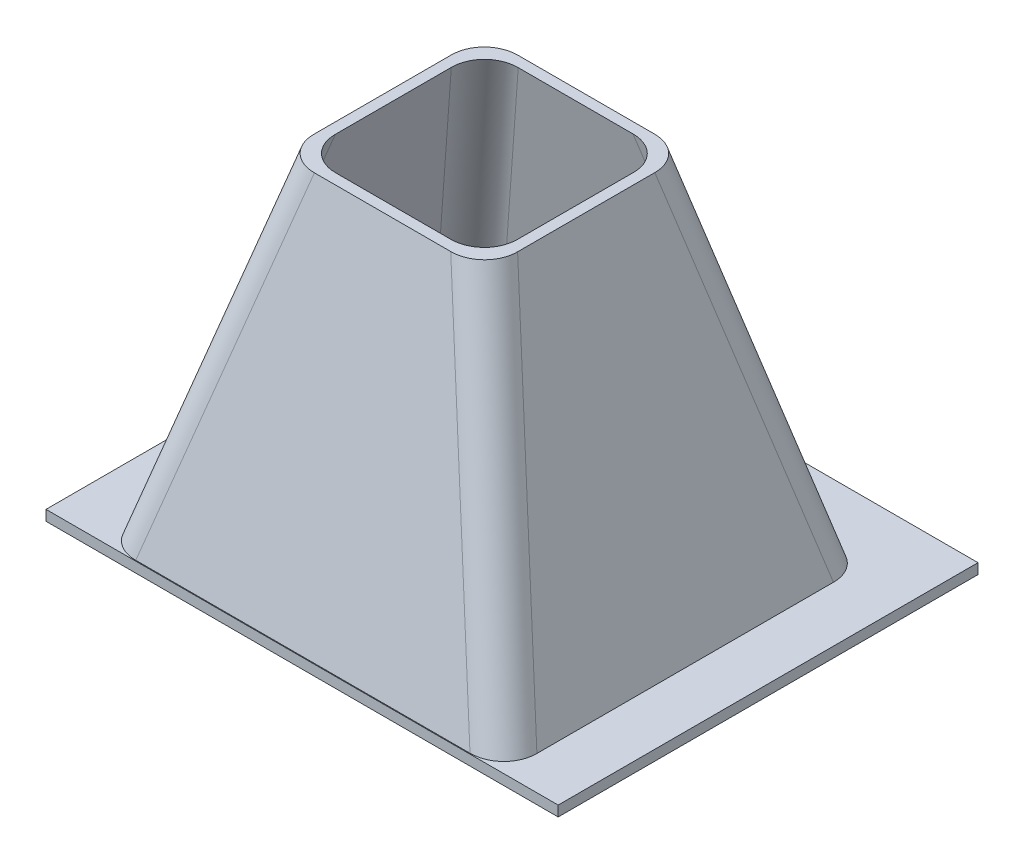
from build123d import *

# Parameters (mm, degrees)
SKETCH1_W           = 59
SKETCH1_H           = 59
BOSS_EXTRUDE1_DEPTH = 100
DRAFT1_ANGLE        = 13
DRAFT2_ANGLE        = 16
SHELL1_T            = -3
CUT_EXTRUDE3_REACH  = 126.734
SKETCH7_W           = 108.386808222
SKETCH7_H           = 97.630604432
SKETCH8_W           = 148.386808222
SKETCH8_H           = 137.630604432
SKETCH8_W_2         = 108.386808222
SKETCH8_H_2         = 97.630604432
BOSS_EXTRUDE7_DEPTH = 3
FILLET5_R           = 10
SKETCH9_R           = 3.5
CUT_EXTRUDE4_DEPTH  = 3
CUT_EXTRUDE5_REACH  = 146.393
SKETCH10_W          = 148.386808222
SKETCH10_H          = 16


with BuildPart() as part:
    # Sketch1 → Boss-Extrude1 (new body)
    with BuildSketch(Plane(origin=(0, 0, 0), x_dir=(1, 0, 0), z_dir=(0, 1, 0))):
        Rectangle(SKETCH1_W, SKETCH1_H)
    extrude(amount=-BOSS_EXTRUDE1_DEPTH)

    # Draft1
    draft1_faces = [part.faces().sort_by_distance(p)[0] for p in [
        (0, -50, 29.5),
        (0, -50, -29.5),
    ]]
    draft(draft1_faces, Plane.ZX, DRAFT1_ANGLE)

    # Draft2
    draft2_faces = [part.faces().sort_by_distance(p)[0] for p in [
        (-29.5, -54.687479947, 0),
        (29.5, -54.687479947, 0),
    ]]
    draft(draft2_faces, Plane.ZX, DRAFT2_ANGLE)

    # Shell1
    shell1_openings = [part.faces().sort_by_distance(p)[0] for p in [
        (0, 0, 0),
    ]]
    offset(amount=SHELL1_T, openings=shell1_openings, kind=Kind.INTERSECTION)

    # Sketch7 → Cut-Extrude3 (cut, up to next)
    with BuildSketch(Plane(origin=(0, -97, 0), x_dir=(1, 0, 0), z_dir=(0, 1, 0)), mode=Mode.PRIVATE) as cut_extrude3_sk1:
        Rectangle(SKETCH7_W, SKETCH7_H)
    cut_extrude3_tool1 = extrude(cut_extrude3_sk1.sketch, amount=-CUT_EXTRUDE3_REACH, mode=Mode.PRIVATE) & part.part
    add(cut_extrude3_tool1.solids().sort_by_distance((0, -97, 0))[0], mode=Mode.SUBTRACT)

    # Sketch8 → Boss-Extrude7 (add)
    with BuildSketch(Plane.XZ.offset(100)):
        Rectangle(SKETCH8_W, SKETCH8_H)
        Rectangle(SKETCH8_W_2, SKETCH8_H_2, mode=Mode.SUBTRACT)
    extrude(amount=BOSS_EXTRUDE7_DEPTH)

    # Fillet5
    # the kernel refuses this fillet: 10 mm, written as the material it adds along each edge
    with BuildSketch(Plane(origin=(60.515709798, -119.048500171, 53.905599567), x_dir=(0.05971785506372287, -0.20826091030442337, -0.9762485190901757), z_dir=(-0.26909056042227797, 0.9384303071178944, -0.2166537075017155))) as fillet5_piece_1_section:
        with BuildLine():
            CenterArc((FILLET5_R * 0.939803414436, FILLET5_R), FILLET5_R, 183.554900224, 86.445099776)
            Line((-FILLET5_R * 0.0582724297082, FILLET5_R * 0.937995086192), (0, 0))
            Line((0, 0), (FILLET5_R * 0.939803414436, 0))
        make_face()
    fillet5_piece_1 = extrude(amount=150.354266344, mode=Mode.PRIVATE)
    fillet5_piece_1 = split(fillet5_piece_1, bisect_by=Plane(origin=(38.566536387, -103, 35.845693728), z_dir=(0, 1, 0)), keep=Keep.TOP, mode=Mode.PRIVATE)
    fillet5_piece_1 = split(fillet5_piece_1, bisect_by=Plane(origin=(38.566536387, 0, 35.845693728), z_dir=(0, -1, 0)), keep=Keep.TOP, mode=Mode.PRIVATE)
    add(fillet5_piece_1)
    with BuildSketch(Plane(origin=(60.515709798, -119.048500171, -53.905599567), x_dir=(0.059717855063722874, -0.2082609103044234, 0.9762485190901756), z_dir=(-0.26909056042227797, 0.9384303071178944, 0.2166537075017155))) as fillet5_piece_2_section:
        with BuildLine():
            CenterArc((FILLET5_R * 0.939803414436, -FILLET5_R), FILLET5_R, 90, 86.445099776)
            Line((-FILLET5_R * 0.0582724297082, -FILLET5_R * 0.937995086192), (0, 0))
            Line((0, 0), (FILLET5_R * 0.939803414436, 0))
        make_face()
    fillet5_piece_2 = extrude(amount=150.354266344, mode=Mode.PRIVATE)
    fillet5_piece_2 = split(fillet5_piece_2, bisect_by=Plane(origin=(38.566536387, -103, -35.845693728), z_dir=(0, 1, 0)), keep=Keep.TOP, mode=Mode.PRIVATE)
    fillet5_piece_2 = split(fillet5_piece_2, bisect_by=Plane(origin=(38.566536387, 0, -35.845693728), z_dir=(0, -1, 0)), keep=Keep.TOP, mode=Mode.PRIVATE)
    add(fillet5_piece_2)
    with BuildSketch(Plane(origin=(-60.515709798, -119.048500171, -53.905599567), x_dir=(0.9631148790729092, -0.26219378679175015, -0.06053220528097297), z_dir=(0.26909056042227797, 0.9384303071178944, 0.2166537075017155))) as fillet5_piece_3_section:
        with BuildLine():
            CenterArc((FILLET5_R * 0.939803414436, -FILLET5_R), FILLET5_R, 90, 86.445099776)
            Line((-FILLET5_R * 0.0582724297082, -FILLET5_R * 0.937995086192), (0, 0))
            Line((0, 0), (FILLET5_R * 0.939803414436, 0))
        make_face()
    fillet5_piece_3 = extrude(amount=150.354266344, mode=Mode.PRIVATE)
    fillet5_piece_3 = split(fillet5_piece_3, bisect_by=Plane(origin=(-38.566536387, -103, -35.845693728), z_dir=(0, 1, 0)), keep=Keep.TOP, mode=Mode.PRIVATE)
    fillet5_piece_3 = split(fillet5_piece_3, bisect_by=Plane(origin=(-38.566536387, 0, -35.845693728), z_dir=(0, -1, 0)), keep=Keep.TOP, mode=Mode.PRIVATE)
    add(fillet5_piece_3)
    with BuildSketch(Plane(origin=(-20.056796005, 22.048500171, 21.330790325), x_dir=(-0.059717855063722264, -0.2082609103044235, -0.9762485190901756), z_dir=(-0.26909056042227797, -0.9384303071178944, 0.2166537075017155))) as fillet5_piece_4_section:
        with BuildLine():
            CenterArc((FILLET5_R * 0.939803414436, FILLET5_R), FILLET5_R, 183.554900224, 86.445099776)
            Line((-FILLET5_R * 0.0582724297082, FILLET5_R * 0.937995086192), (0, 0))
            Line((0, 0), (FILLET5_R * 0.939803414436, 0))
        make_face()
    fillet5_piece_4 = extrude(amount=150.354266344, mode=Mode.PRIVATE)
    fillet5_piece_4 = split(fillet5_piece_4, bisect_by=Plane(origin=(-38.566536387, -103, 35.845693728), z_dir=(0, 1, 0)), keep=Keep.TOP, mode=Mode.PRIVATE)
    fillet5_piece_4 = split(fillet5_piece_4, bisect_by=Plane(origin=(-38.566536387, 0, 35.845693728), z_dir=(0, -1, 0)), keep=Keep.TOP, mode=Mode.PRIVATE)
    add(fillet5_piece_4)
    # the kernel refuses this fillet: 10 mm, written as the material it takes off along each edge
    with BuildSketch(Plane(origin=(-23.177694313, 22.048500171, -24.409702648), x_dir=(-0.05971785506372238, -0.20826091030442354, 0.9762485190901757), z_dir=(-0.26909056042227797, -0.9384303071178944, -0.2166537075017155))) as fillet5_2_piece_1_section:
        with BuildLine():
            CenterArc((FILLET5_R * 0.939803414436, -FILLET5_R), FILLET5_R, 90, 86.445099776)
            Line((-FILLET5_R * 0.0582724297082, -FILLET5_R * 0.937995086192), (0, 0))
            Line((0, 0), (FILLET5_R * 0.939803414436, 0))
        make_face()
    fillet5_2_piece_1 = extrude(amount=153.551094044, mode=Mode.PRIVATE)
    fillet5_2_piece_1 = split(fillet5_2_piece_1, bisect_by=Plane(origin=(-41.676990214, -100, -38.91219309), z_dir=(0, 1, 0)), keep=Keep.TOP, mode=Mode.PRIVATE)
    add(fillet5_2_piece_1, mode=Mode.SUBTRACT)
    with BuildSketch(Plane(origin=(23.177694313, 22.048500171, -24.409702648), x_dir=(0.059717855063722375, -0.2082609103044235, 0.9762485190901756), z_dir=(0.26909056042227797, -0.9384303071178944, -0.2166537075017155))) as fillet5_2_piece_2_section:
        with BuildLine():
            CenterArc((FILLET5_R * 0.939803414436, FILLET5_R), FILLET5_R, 183.554900224, 86.445099776)
            Line((-FILLET5_R * 0.0582724297082, FILLET5_R * 0.937995086192), (0, 0))
            Line((0, 0), (FILLET5_R * 0.939803414436, 0))
        make_face()
    fillet5_2_piece_2 = extrude(amount=153.551094044, mode=Mode.PRIVATE)
    fillet5_2_piece_2 = split(fillet5_2_piece_2, bisect_by=Plane(origin=(41.676990214, -100, -38.91219309), z_dir=(0, 1, 0)), keep=Keep.TOP, mode=Mode.PRIVATE)
    add(fillet5_2_piece_2, mode=Mode.SUBTRACT)
    with BuildSketch(Plane(origin=(23.177694313, 22.048500171, 24.409702648), x_dir=(-0.9631148790729092, -0.26219378679175015, 0.06053220528097312), z_dir=(0.26909056042227797, -0.9384303071178944, 0.2166537075017155))) as fillet5_2_piece_3_section:
        with BuildLine():
            CenterArc((FILLET5_R * 0.939803414436, FILLET5_R), FILLET5_R, 183.554900224, 86.445099776)
            Line((-FILLET5_R * 0.0582724297082, FILLET5_R * 0.937995086192), (0, 0))
            Line((0, 0), (FILLET5_R * 0.939803414436, 0))
        make_face()
    fillet5_2_piece_3 = extrude(amount=153.551094044, mode=Mode.PRIVATE)
    fillet5_2_piece_3 = split(fillet5_2_piece_3, bisect_by=Plane(origin=(41.676990214, -100, 38.91219309), z_dir=(0, 1, 0)), keep=Keep.TOP, mode=Mode.PRIVATE)
    add(fillet5_2_piece_3, mode=Mode.SUBTRACT)
    with BuildSketch(Plane(origin=(-23.177694313, 22.048500171, 24.409702648), x_dir=(0.9631148790729092, -0.26219378679175015, 0.06053220528097312), z_dir=(-0.26909056042227797, -0.9384303071178944, 0.2166537075017155))) as fillet5_2_piece_4_section:
        with BuildLine():
            CenterArc((FILLET5_R * 0.939803414436, -FILLET5_R), FILLET5_R, 90, 86.445099776)
            Line((-FILLET5_R * 0.0582724297082, -FILLET5_R * 0.937995086192), (0, 0))
            Line((0, 0), (FILLET5_R * 0.939803414436, 0))
        make_face()
    fillet5_2_piece_4 = extrude(amount=153.551094044, mode=Mode.PRIVATE)
    fillet5_2_piece_4 = split(fillet5_2_piece_4, bisect_by=Plane(origin=(-41.676990214, -100, 38.91219309), z_dir=(0, 1, 0)), keep=Keep.TOP, mode=Mode.PRIVATE)
    add(fillet5_2_piece_4, mode=Mode.SUBTRACT)

    # Sketch9 → Cut-Extrude4 (cut)
    with BuildSketch(Plane(origin=(0, -100, 0), x_dir=(1, 0, 0), z_dir=(0, 1, 0))):
        with Locations(Location((0, 57.815302216, 0), (0, 0, 270))):
            Circle(SKETCH9_R)
    extrude(amount=-CUT_EXTRUDE4_DEPTH, mode=Mode.SUBTRACT)

    # Sketch10 → Cut-Extrude5 (cut, up to next)
    with BuildSketch(Plane.XZ.offset(103), mode=Mode.PRIVATE) as cut_extrude5_sk1:
        with Locations((0, 60.815302216)):
            Rectangle(SKETCH10_W, SKETCH10_H)
    cut_extrude5_tool1 = extrude(cut_extrude5_sk1.sketch, amount=-CUT_EXTRUDE5_REACH, mode=Mode.PRIVATE) & part.part
    add(cut_extrude5_tool1.solids().sort_by_distance((0, -103, 60.815302))[0], mode=Mode.SUBTRACT)


solid = part.part
